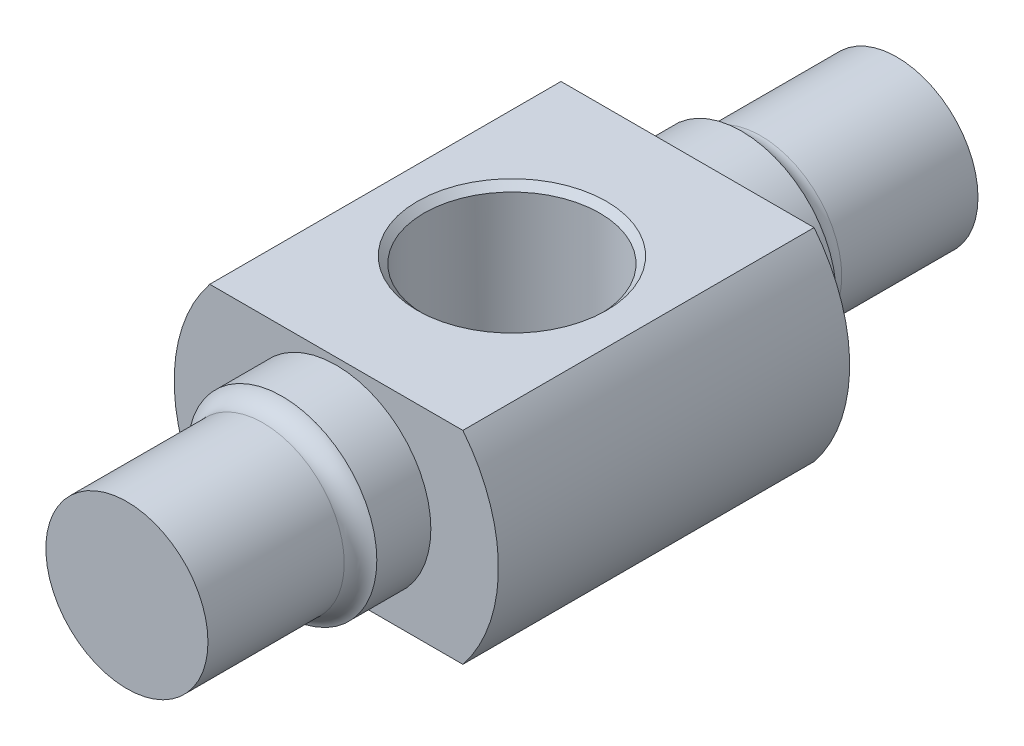
from build123d import *

# Parameters (mm, degrees)
SCHIZZO2_R                   = 6
ESTRUSIONE_ESTRUSIONE1_DEPTH = 11.5
SCHIZZO3_R                   = 7
ESTRUSIONE_ESTRUSIONE2_DEPTH = 4
ESTRUSIONE_ESTRUSIONE3_DEPTH = 26
RACCORDO2_R                  = 1.5
SCHIZZO6_R                   = 6.5
TAGLIO_ESTRUSIONE2_DEPTH     = 61.149812967
SMUSSO2_SIZE                 = 0.5


with BuildPart() as part:
    # Schizzo2 → Estrusione-Estrusione1 (new body)
    with BuildSketch(Plane.XY):
        Circle(SCHIZZO2_R)
    estrusione_estrusione1 = extrude(amount=ESTRUSIONE_ESTRUSIONE1_DEPTH)

    # Schizzo3 → Estrusione-Estrusione2 (add)
    with BuildSketch(Plane.XY.offset(11.5)):
        Circle(SCHIZZO3_R)
    estrusione_estrusione2 = extrude(amount=ESTRUSIONE_ESTRUSIONE2_DEPTH)

    # Schizzo4 → Estrusione-Estrusione3 (add)
    with BuildSketch(Plane.XY.offset(15.5)):
        with BuildLine():
            Line((-9.367496998, 7.5), (9.367496998, 7.5))
            ThreePointArc((9.367496998, 7.5), (12, 0), (9.367496998, -7.5))
            Line((9.367496998, -7.5), (-9.367496998, -7.5))
            ThreePointArc((-9.367496998, -7.5), (-12, 0), (-9.367496998, 7.5))
        make_face()
    extrude(amount=ESTRUSIONE_ESTRUSIONE3_DEPTH)

    # Specchia1: Estrusione-Estrusione2 across plane
    add(estrusione_estrusione2.mirror(Plane.XY.offset(28.5)))

    # Specchia2: Estrusione-Estrusione1 across plane
    add(estrusione_estrusione1.mirror(Plane.XY.offset(28.5)))

    # Raccordo2
    # the kernel refuses this fillet: 1.5 mm, written as the material it adds along each edge
    with BuildSketch(Plane(origin=(0, 0, 45.5), x_dir=(1, 0, 0), z_dir=(0, -1, 0))) as raccordo2_piece_1:
        with BuildLine():
            CenterArc((7.5, 1.414213562), RACCORDO2_R, 180, 70.528779366)
            Line((6, 1.414213562), (5.97, 1.414213562))
            Line((5.97, 1.414213562), (5.97, 0))
            Line((5.97, 0), (6, -0.03))
            ThreePointArc((6, -0.03), (6.5, -0.03), (6.99, -0.028284271))
            Line((6.99, -0.028284271), (7, 0))
        make_face()
    revolve(axis=Axis((0, 0, 45.5), (0, 0, 1)))
    with BuildSketch(Plane(origin=(0, 0, 11.5), x_dir=(1, 0, 0), z_dir=(0, -1, 0))) as raccordo2_piece_2:
        with BuildLine():
            CenterArc((7.5, -1.414213562), RACCORDO2_R, 109.471220634, 70.528779366)
            Line((6, -1.414213562), (5.97, -1.414213562))
            Line((5.97, -1.414213562), (5.97, 0))
            Line((5.97, 0), (6, 0.03))
            ThreePointArc((6, 0.03), (6.5, 0.03), (6.99, 0.028284271))
            Line((6.99, 0.028284271), (7, 0))
        make_face()
    revolve(axis=Axis((0, 0, 11.5), (0, 0, 1)))

    # Schizzo6 → Taglio-Estrusione2 (cut, through all)
    with BuildSketch(Plane(origin=(0, 7.5, 0), x_dir=(1, 0, 0), z_dir=(0, 1, 0))):
        with Locations(Location((0, -28.5, 0), (0, 0, 270))):
            Circle(SCHIZZO6_R)
    extrude(amount=-TAGLIO_ESTRUSIONE2_DEPTH, mode=Mode.SUBTRACT)

    # Smusso2
    smusso2_edges = [part.edges().sort_by_distance(p)[0] for p in [
        (0, -7.5, 22),
        (0, 7.5, 22),
    ]]
    chamfer(smusso2_edges, length=SMUSSO2_SIZE)


solid = part.part
